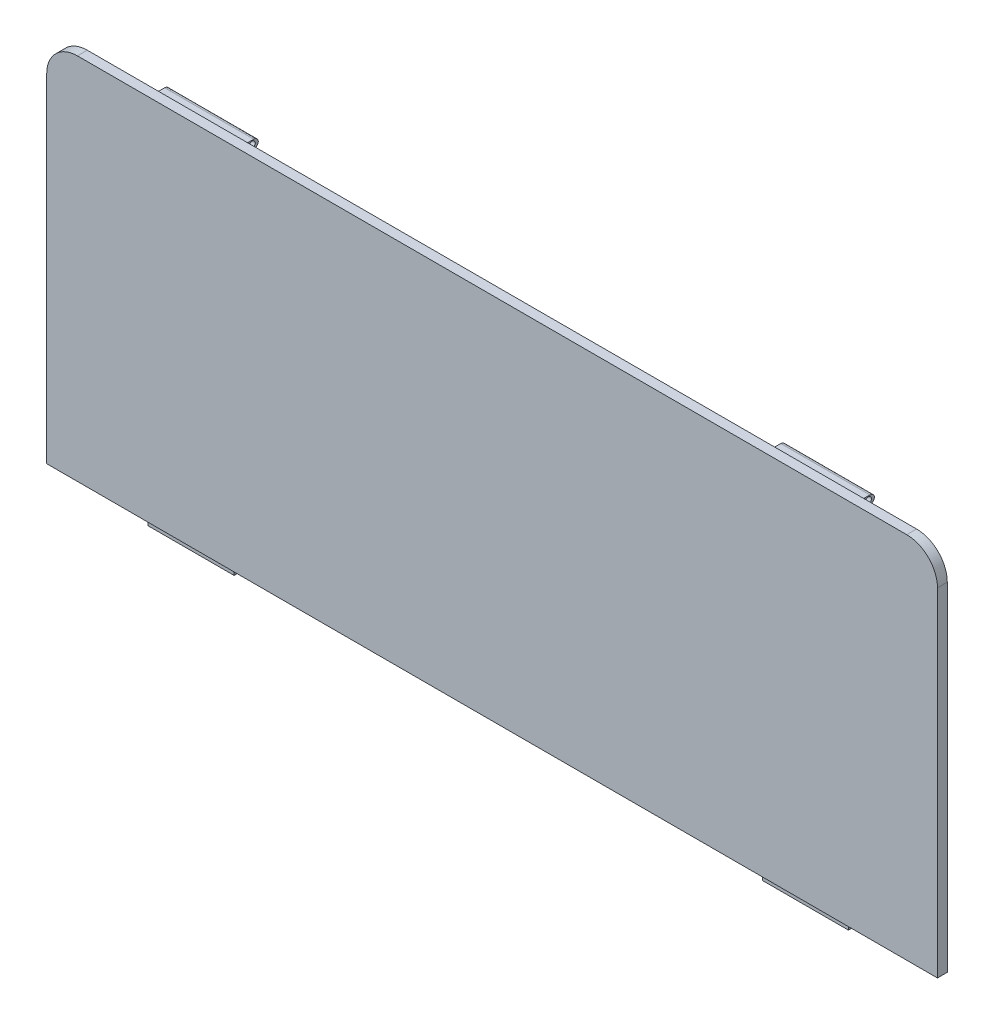
from build123d import *

# Parameters (mm, degrees)
EXTRUDE_1_DEPTH     = 3.2
SKETCH_2_W          = 28
SKETCH_2_H          = 3
CUT_EXTRUDE_1_DEPTH = 2
SKETCH_3_W          = 29
SKETCH_3_H          = 2.8
EXTRUDE_2_DEPTH     = 6.5
SKETCH_4_R          = 1
CUT_EXTRUDE_2_DEPTH = 270.771576627
FILLET_1_R          = 1.5


with BuildPart() as part:
    # 草图1 → 凸台-拉伸1 (new body)
    with BuildSketch(Plane.XY):
        with BuildLine():
            Line((-107.202531646, -47.623114492), (64.797468354, -47.623114492))
            Line((64.797468354, -47.623114492), (64.797468354, -50.623114492))
            Line((64.797468354, -50.623114492), (92.797468354, -50.623114492))
            Line((92.797468354, -50.623114492), (92.797468354, -47.623114492))
            Line((92.797468354, -47.623114492), (123.797468354, -47.623114492))
            Line((123.797468354, -47.623114492), (123.797468354, 62.376885508))
            ThreePointArc((123.797468354, 62.376885508), (120.868536166, 69.447953319), (113.797468354, 72.376885508))
            Line((113.797468354, 72.376885508), (-156.202531646, 72.376885508))
            ThreePointArc((-156.202531646, 72.376885508), (-163.273599457, 69.447953319), (-166.202531646, 62.376885508))
            Line((-166.202531646, 62.376885508), (-166.202531646, -47.623114492))
            Line((-166.202531646, -47.623114492), (-135.202531646, -47.623114492))
            Line((-135.202531646, -47.623114492), (-135.202531646, -50.623114492))
            Line((-135.202531646, -50.623114492), (-107.202531646, -50.623114492))
            Line((-107.202531646, -50.623114492), (-107.202531646, -47.623114492))
        make_face()
    extrude(amount=EXTRUDE_1_DEPTH)

    # 草图2 → 切除-拉伸1 (cut)
    with BuildSketch(Plane.XY.offset(3.2)):
        with Locations((-121.202531646, -49.123114492)):
            Rectangle(SKETCH_2_W, SKETCH_2_H)
        with Locations((78.797468354, -49.123114492)):
            Rectangle(SKETCH_2_W, SKETCH_2_H)
    extrude(amount=-CUT_EXTRUDE_1_DEPTH, mode=Mode.SUBTRACT)

    # 草图3 → 凸台-拉伸2 (add)
    with BuildSketch(Plane.XY):
        with Locations((-121.502531646, 67.976885508)):
            Rectangle(SKETCH_3_W, SKETCH_3_H)
        with Locations((79.097468354, 67.976885508)):
            Rectangle(SKETCH_3_W, SKETCH_3_H)
    extrude(amount=-EXTRUDE_2_DEPTH)

    # 草图4 → 切除-拉伸2 (cut, through all)
    with BuildSketch(Plane(origin=(93.597468354, 0, 0), x_dir=(0, 0, -1), z_dir=(1, 0, 0))):
        with Locations((4.5, 68.076885508)):
            Circle(SKETCH_4_R)
    extrude(amount=-CUT_EXTRUDE_2_DEPTH, mode=Mode.SUBTRACT)

    # 圆角1
    # the kernel refuses this fillet: 1.5 mm, written as the material it takes off along each edge
    with BuildSketch(Plane(origin=(60.847468354, 66.576885508, -6.5), x_dir=(0, 0, 1), z_dir=(1, 0, 0)), Plane(origin=(97.347468354, 69.376885508, -6.5), x_dir=(0, 0, 1), z_dir=(-1, 0, 0))) as fillet_1_piece_1:
        with BuildLine():
            CenterArc((FILLET_1_R, -FILLET_1_R), FILLET_1_R, 90, 90)
            Line((0, -FILLET_1_R), (0, 0))
            Line((0, 0), (FILLET_1_R, 0))
        make_face()
    extrude(amount=36.5, mode=Mode.SUBTRACT)
    with BuildSketch(Plane(origin=(-103.252531646, 66.576885508, -6.5), x_dir=(0, 0, 1), z_dir=(-1, 0, 0)), Plane(origin=(-139.752531646, 69.376885508, -6.5), x_dir=(0, 0, 1), z_dir=(1, 0, 0))) as fillet_1_piece_2:
        with BuildLine():
            CenterArc((FILLET_1_R, FILLET_1_R), FILLET_1_R, 180, 90)
            Line((0, FILLET_1_R), (0, 0))
            Line((0, 0), (FILLET_1_R, 0))
        make_face()
    extrude(amount=36.5, mode=Mode.SUBTRACT)


solid = part.part
